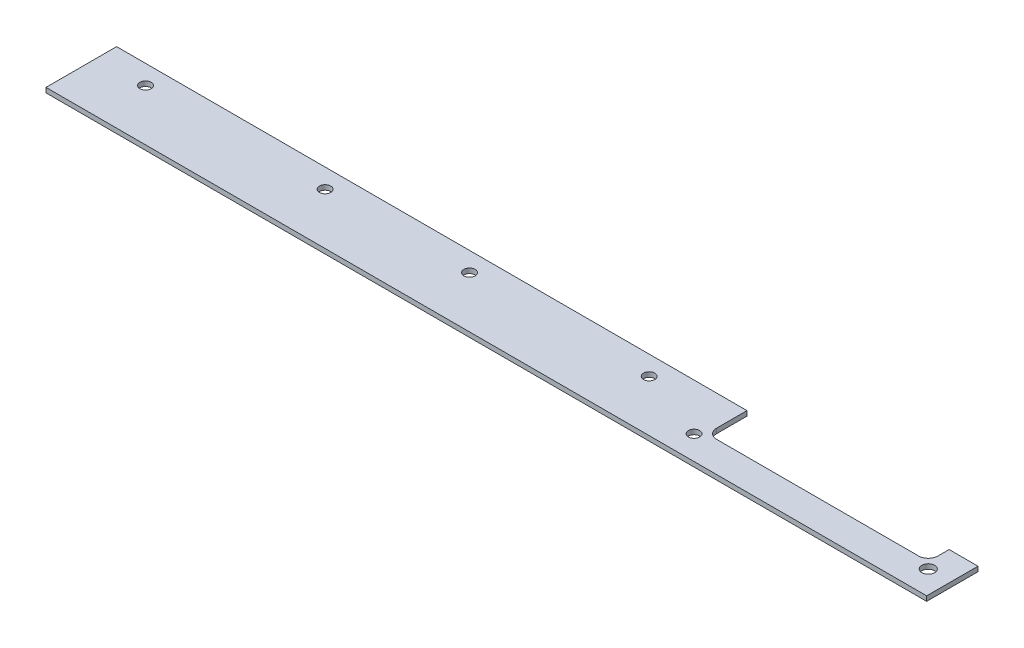
from build123d import *

# Parameters (mm, degrees)
SKETCH_1_R      = 1.75
SKETCH_1_R_2    = 2
EXTRUDE_1_DEPTH = 1.5


with BuildPart() as part:
    # Эскиз1 → Бобышка-Вытянуть1 (new body)
    with BuildSketch(Plane(origin=(0, 0, 0), x_dir=(1, 0, 0), z_dir=(0, 1, 0))):
        with BuildLine():
            Line((196.5, 22), (196.5, 12.5))
            ThreePointArc((196.5, 12.5), (197.378679656, 10.378679656), (199.5, 9.5))
            Line((199.5, 9.5), (262.5, 9.5))
            ThreePointArc((262.5, 9.5), (264.621320344, 10.378679656), (265.5, 12.5))
            Line((265.5, 12.5), (265.5, 16))
            Line((265.5, 16), (274.5, 16))
            Line((274.5, 16), (274.5, 0))
            Line((274.5, 0), (0, 0))
            Line((0, 0), (0, 22))
            Line((0, 22), (196.5, 22))
        make_face()
        with Locations((194.5, 7.5)):
            Circle(SKETCH_1_R, mode=Mode.SUBTRACT)
        with Locations((71, 16)):
            Circle(SKETCH_1_R, mode=Mode.SUBTRACT)
        with Locations((15, 16)):
            Circle(SKETCH_1_R, mode=Mode.SUBTRACT)
        with Locations((116, 16)):
            Circle(SKETCH_1_R, mode=Mode.SUBTRACT)
        with Locations((172, 16)):
            Circle(SKETCH_1_R, mode=Mode.SUBTRACT)
        with Locations((267.5, 7.5)):
            Circle(SKETCH_1_R_2, mode=Mode.SUBTRACT)
    extrude(amount=EXTRUDE_1_DEPTH)


solid = part.part
